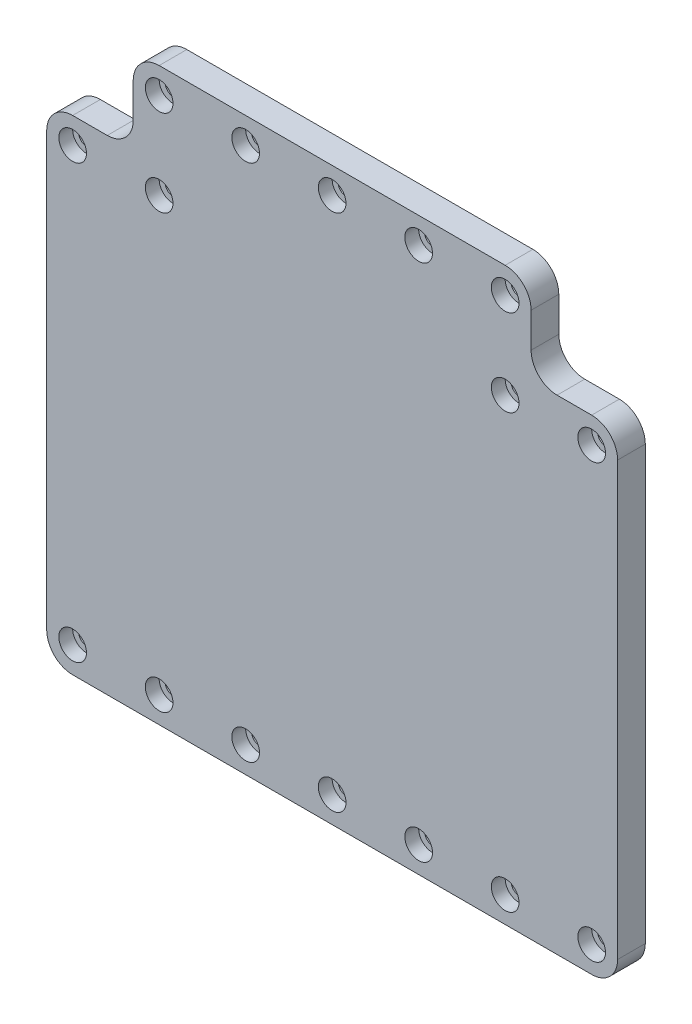
from build123d import *

# Parameters (mm, degrees)
BOSS_EXTRUDE1_DEPTH            = 8
CBORE_FOR_M4_SHCS1_D           = 4.5
CBORE_FOR_M4_SHCS1_CBORE_D     = 8
CBORE_FOR_M4_SHCS1_CBORE_DEPTH = 4


with BuildPart() as part:
    # Sketch1 → Boss-Extrude1 (new body)
    with BuildSketch(Plane.XY):
        with BuildLine():
            Line((-50, 67.5), (50, 67.5))
            ThreePointArc((50, 67.5), (55.303300859, 65.303300859), (57.5, 60))
            Line((57.5, 60), (57.5, 50))
            ThreePointArc((57.5, 50), (59.696699141, 44.696699141), (65, 42.5))
            Line((65, 42.5), (75, 42.5))
            ThreePointArc((75, 42.5), (80.303300859, 40.303300859), (82.5, 35))
            Line((82.5, 35), (82.5, -90))
            ThreePointArc((82.5, -90), (80.303300859, -95.303300859), (75, -97.5))
            Line((75, -97.5), (-75, -97.5))
            ThreePointArc((-75, -97.5), (-80.303300859, -95.303300859), (-82.5, -90))
            Line((-82.5, -90), (-82.5, 35))
            ThreePointArc((-82.5, 35), (-80.303300859, 40.303300859), (-75, 42.5))
            Line((-75, 42.5), (-65, 42.5))
            ThreePointArc((-65, 42.5), (-59.696699141, 44.696699141), (-57.5, 50))
            Line((-57.5, 50), (-57.5, 60))
            ThreePointArc((-57.5, 60), (-55.303300859, 65.303300859), (-50, 67.5))
        make_face()
    extrude(amount=-BOSS_EXTRUDE1_DEPTH)

    # CBORE for M4 SHCS1 (through all)
    with Locations(Plane.XY):
        with Locations((75, -90), (-25, 60), (-75, 35), (-50, 35), (-50, 60), (0, 60), (25, 60), (50, 60), (50, 35), (75, 35), (-25, -90), (-75, -90), (0, -90), (25, -90), (-50, -90), (50, -90)):
            CounterBoreHole(CBORE_FOR_M4_SHCS1_D / 2, CBORE_FOR_M4_SHCS1_CBORE_D / 2, CBORE_FOR_M4_SHCS1_CBORE_DEPTH)


solid = part.part
